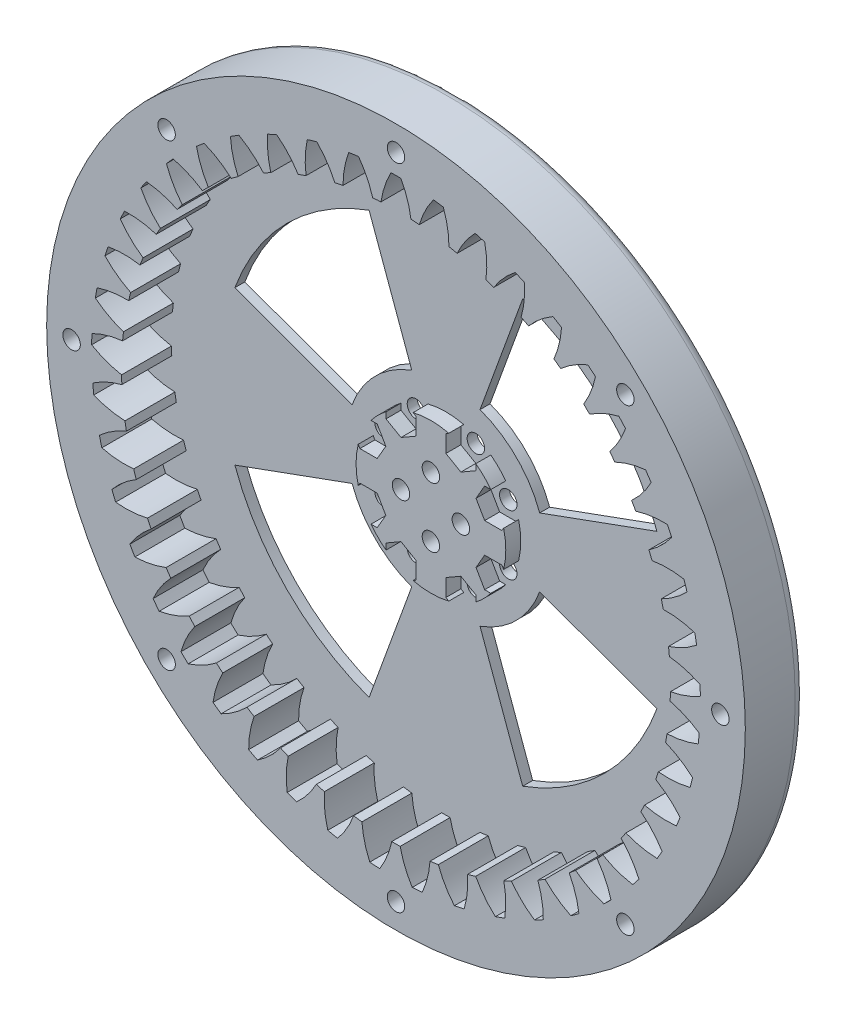
from build123d import *

# Parameters (mm, degrees)
SKETCH1_R           = 70
SKETCH1_R_2         = 55
BOSS_EXTRUDE1_DEPTH = 10
CUT_EXTRUDE1_DEPTH  = 100.498743711
CIRPATTERN1_COUNT   = 45
BOSS_EXTRUDE2_START = 2
SKETCH4_R           = 70
BOSS_EXTRUDE2_DEPTH = 2
CUT_EXTRUDE3_DEPTH  = 100.719606899
SKETCH3_R           = 1.75
CUT_EXTRUDE2_DEPTH  = 100.719606899
CIRPATTERN2_COUNT   = 8
SKETCH7_R           = 15
BOSS_EXTRUDE3_DEPTH = 3
SKETCH6_R           = 1.75
CUT_EXTRUDE4_DEPTH  = 100.719606899
CIRPATTERN3_COUNT   = 4
FILLET1_R           = 2
SKETCH8_R           = 1.75
CUT_EXTRUDE5_DEPTH  = 100.719606899
CUT_EXTRUDE6_DEPTH  = 3
CIRPATTERN4_COUNT   = 2
CIRPATTERN4_ANGLE   = 90


with BuildPart() as part:
    # Sketch1 → Boss-Extrude1 (new body)
    with BuildSketch(Plane.XY):
        Circle(SKETCH1_R)
        Circle(SKETCH1_R_2, mode=Mode.SUBTRACT)
    extrude(amount=BOSS_EXTRUDE1_DEPTH)

    # Sketch2 → Cut-Extrude1 (cut, through all)
    with BuildSketch(Plane.XY.offset(10)):
        with BuildLine():
            ThreePointArc((1, 60.991802728), (0, 61), (-1, 60.991802728))
            ThreePointArc((-1, 60.991802728), (-2.269117025, 58.043579225), (-3, 54.918120871))
            ThreePointArc((-3, 54.918120871), (0, 55), (3, 54.918120871))
            ThreePointArc((3, 54.918120871), (2.269117025, 58.043579225), (1, 60.991802728))
        make_face()
    cut_extrude1 = extrude(amount=-CUT_EXTRUDE1_DEPTH, mode=Mode.SUBTRACT)

    # CirPattern1: Cut-Extrude1 ×45 about axis
    cirpattern1_axis = Axis((0, 0, 0), (0, 0, 1))
    for i in range(1, CIRPATTERN1_COUNT):
        add(cut_extrude1.rotate(cirpattern1_axis, i * 360 / CIRPATTERN1_COUNT), mode=Mode.SUBTRACT)

    # Sketch4 → Boss-Extrude2 (add)
    with BuildSketch(Plane(origin=(0, 0, 0), x_dir=(-1, 0, 0), z_dir=(0, 0, -1)).offset(BOSS_EXTRUDE2_START)):
        Circle(SKETCH4_R)
    extrude(amount=-BOSS_EXTRUDE2_DEPTH)

    # Sketch5 → Cut-Extrude3 (cut, through all)
    with BuildSketch(Plane(origin=(0, 0, -2), x_dir=(-1, 0, 0), z_dir=(0, 0, -1))):
        with BuildLine():
            Line((6.840402867, 18.793852416), (15.39090645, 42.286167935))
            ThreePointArc((15.39090645, 42.286167935), (31.819805153, 31.819805153), (42.286167935, 15.39090645))
            Line((42.286167935, 15.39090645), (18.793852416, 6.840402867))
            ThreePointArc((18.793852416, 6.840402867), (14.142135624, 14.142135624), (6.840402867, 18.793852416))
        make_face()
    cut_extrude3 = extrude(amount=-CUT_EXTRUDE3_DEPTH, mode=Mode.SUBTRACT)

    # Sketch3 → Cut-Extrude2 (cut, through all)
    with BuildSketch(Plane.XY.offset(10)):
        with Locations((0, 65)):
            Circle(SKETCH3_R)
    cut_extrude2 = extrude(amount=-CUT_EXTRUDE2_DEPTH, mode=Mode.SUBTRACT)

    # CirPattern2: Cut-Extrude2 ×8 about axis
    cirpattern2_axis = Axis((0, 0, 0), (0, 0, 1))
    for i in range(1, CIRPATTERN2_COUNT):
        add(cut_extrude2.rotate(cirpattern2_axis, i * 360 / CIRPATTERN2_COUNT), mode=Mode.SUBTRACT)

    # Sketch7 → Boss-Extrude3 (add)
    with BuildSketch(Plane.XY):
        with Locations(Location((0, 0, 0), (0, 0, 180))):
            Circle(SKETCH7_R)
    extrude(amount=BOSS_EXTRUDE3_DEPTH)

    # Sketch6 → Cut-Extrude4 (cut, through all)
    with BuildSketch(Plane(origin=(0, 0, -2), x_dir=(-1, 0, 0), z_dir=(0, 0, -1))):
        with Locations((0, 6)):
            Circle(SKETCH6_R)
    cut_extrude4 = extrude(amount=-CUT_EXTRUDE4_DEPTH, mode=Mode.SUBTRACT)

    # CirPattern3: Cut-Extrude3, Cut-Extrude4 ×4 about axis
    cirpattern3_axis = Axis((0, 0, 0), (0, 0, 1))
    add([cut_extrude3.rotate(cirpattern3_axis, i * 360 / CIRPATTERN3_COUNT) for i in range(1, CIRPATTERN3_COUNT)], mode=Mode.SUBTRACT)
    add([cut_extrude4.rotate(cirpattern3_axis, i * 360 / CIRPATTERN3_COUNT) for i in range(1, CIRPATTERN3_COUNT)], mode=Mode.SUBTRACT)

    # Fillet1
    fillet1_edges = [part.edges().sort_by_distance(p)[0] for p in [
        (70, 0, -2),
    ]]
    fillet(fillet1_edges, radius=FILLET1_R - 0.0001)  # a hair under: the kernel refuses the full size

    # Sketch8 → Cut-Extrude5 (cut, through all)
    with BuildSketch(Plane(origin=(0, 0, -2), x_dir=(-1, 0, 0), z_dir=(0, 0, -1))):
        with Locations((-12.5, 6)):
            Circle(SKETCH8_R)
        with Locations((12.5, 6)):
            Circle(SKETCH8_R)
        with Locations((12.5, -6)):
            Circle(SKETCH8_R)
        with Locations((-12.5, -6)):
            Circle(SKETCH8_R)
    cut_extrude5 = extrude(amount=-CUT_EXTRUDE5_DEPTH, mode=Mode.SUBTRACT)

    # Sketch9 → Cut-Extrude6 (cut)
    with BuildSketch(Plane.XY.offset(3)):
        Polygon((-10.767949192, 3), (-9.035898385, 6), (-10.767949192, 9), (-14.232050808, 9), (-15.964101615, 6), (-14.232050808, 3), align=None)
        Polygon((9.035898385, 6), (10.767949192, 3), (14.232050808, 3), (15.964101615, 6), (14.232050808, 9), (10.767949192, 9), align=None)
        Polygon((9.035898385, -6), (10.767949192, -9), (14.232050808, -9), (15.964101615, -6), (14.232050808, -3), (10.767949192, -3), align=None)
        Polygon((-9.035898385, -6), (-10.767949192, -3), (-14.232050808, -3), (-15.964101615, -6), (-14.232050808, -9), (-10.767949192, -9), align=None)
    cut_extrude6 = extrude(amount=-CUT_EXTRUDE6_DEPTH, mode=Mode.SUBTRACT)

    # CirPattern4: Cut-Extrude5, Cut-Extrude6 ×2 about axis
    cirpattern4_axis = Axis((0, 0, 0), (0, 0, 1))
    add([cut_extrude5.rotate(cirpattern4_axis, i * CIRPATTERN4_ANGLE / (CIRPATTERN4_COUNT - 1)) for i in range(1, CIRPATTERN4_COUNT)], mode=Mode.SUBTRACT)
    add([cut_extrude6.rotate(cirpattern4_axis, i * CIRPATTERN4_ANGLE / (CIRPATTERN4_COUNT - 1)) for i in range(1, CIRPATTERN4_COUNT)], mode=Mode.SUBTRACT)


solid = part.part
